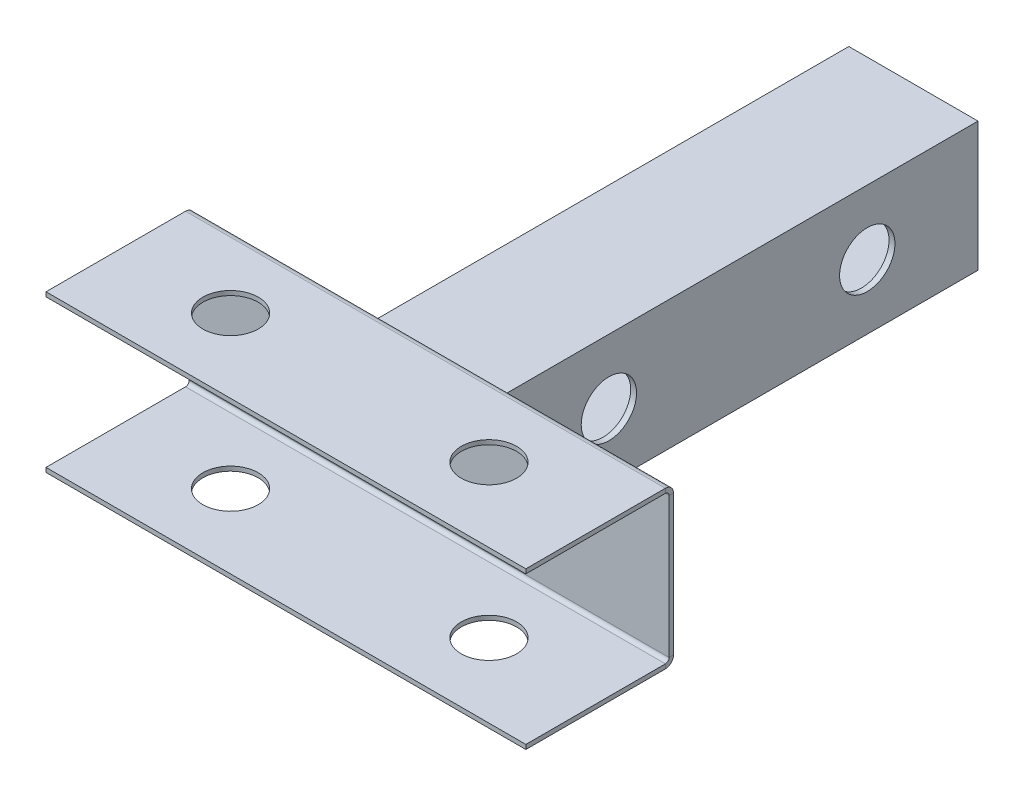
from build123d import *

# Parameters (mm, degrees)
CROQUIS11_W                        = 35
CROQUIS11_H                        = 35
CROQUIS11_W_2                      = 31.8
CROQUIS11_H_2                      = 31.8
CUADRADO_35X35X1_6_1_DEPTH         = 130
CORTAR_EXTRUIR1_DEPTH              = 76.869954527
CORTAR_EXTRUIR1_DEPTH_BACK         = 76.869954527
CROQUIS12_R                        = 7.5
CROQUIS14_W                        = 40
CROQUIS14_H                        = 130
BRIDA_BASE1_DEPTH                  = 1.2
BRIDA_DE_ARISTA1_STRIP_W           = 6.8
BRIDA_DE_ARISTA1_STRIP_H           = 1.2
BRIDA_DE_ARISTA1_STRIP_CUT_DEPTH   = 130
BRIDA_DE_ARISTA1_STRIP_2_W         = 6.8
BRIDA_DE_ARISTA1_STRIP_2_H         = 1.2
BRIDA_DE_ARISTA1_STRIP_CUT_2_DEPTH = 130
BRIDA_DE_ARISTA1_DEPTH             = 130
BRIDA_DE_ARISTA1_BEND_DEPTH        = 130
CORTAR_EXTRUIR2_DEPTH              = 131.567070887
CORTAR_EXTRUIR2_DEPTH_BACK         = 131.567070887
CROQUIS26_R                        = 7.5
S_LIDO_MOVER_COPIAR1_ANGLE         = 90


# Sheet-metal steps are written as plain solids
with BuildPart() as part:
    # Croquis11 → Cuadrado 35X35X1.6(1) (new body)
    with BuildSketch(Plane(origin=(0, 0, 65), x_dir=(-1, 0, 0), z_dir=(0, 0, -1))):
        Rectangle(CROQUIS11_W, CROQUIS11_H)
        Rectangle(CROQUIS11_W_2, CROQUIS11_H_2, mode=Mode.SUBTRACT)
    extrude(amount=CUADRADO_35X35X1_6_1_DEPTH)

    # Croquis12 → Cortar-Extruir1 (cut, two sides: drawn at the far end of the back side and taken through both)
    with BuildSketch(Plane.ZY.offset(17.5).offset(-CORTAR_EXTRUIR1_DEPTH_BACK)):
        with Locations(Location((35, 0, 0), (0, 0, 180))):
            Circle(CROQUIS12_R)
        with Locations(Location((-35, 0, 0), (0, 0, 180))):
            Circle(CROQUIS12_R)
    extrude(amount=CORTAR_EXTRUIR1_DEPTH + CORTAR_EXTRUIR1_DEPTH_BACK, mode=Mode.SUBTRACT)


with BuildPart() as body_2:
    # Croquis14 → Brida base1 (new body)
    with BuildSketch(Plane.XY.offset(65)):
        Rectangle(CROQUIS14_W, CROQUIS14_H)
    extrude(amount=BRIDA_BASE1_DEPTH)

    # Brida de arista1 strip (across the edge) → Brida de arista1 strip cut (cut)
    with BuildSketch(Plane(origin=(20, -65, 66.2), x_dir=(-1, 0, 0), z_dir=(0, 1, 0))):
        with Locations((-2.4, -0.6)):
            Rectangle(BRIDA_DE_ARISTA1_STRIP_W, BRIDA_DE_ARISTA1_STRIP_H)
    extrude(amount=BRIDA_DE_ARISTA1_STRIP_CUT_DEPTH, mode=Mode.SUBTRACT)

    # Brida de arista1 strip 2 (across the edge) → Brida de arista1 strip cut 2 (cut)
    with BuildSketch(Plane(origin=(-20, 65, 66.2), x_dir=(1, 0, 0), z_dir=(0, -1, 0))):
        with Locations((-2.4, -0.6)):
            Rectangle(BRIDA_DE_ARISTA1_STRIP_2_W, BRIDA_DE_ARISTA1_STRIP_2_H)
    extrude(amount=BRIDA_DE_ARISTA1_STRIP_CUT_2_DEPTH, mode=Mode.SUBTRACT)

    # Brida de arista1 section (across the edge) → Brida de arista1 (add)
    with BuildSketch(Plane(origin=(20, -65, 66.2), x_dir=(-1, 0, 0), z_dir=(0, 1, 0))):
        with BuildLine():
            Line((-1.2, 1), (-1.2, 38.8))
            Line((-1.2, 38.8), (0, 38.8))
            Line((0, 38.8), (0, 1))
            ThreePointArc((0, 1), (0.292893219, 0.292893219), (1, 0))
            Line((1, 0), (1, -1.2))
            ThreePointArc((1, -1.2), (-0.555634919, -0.555634919), (-1.2, 1))
        make_face()
    extrude(amount=BRIDA_DE_ARISTA1_DEPTH)

    # Brida de arista1 section 2 (across the edge) → Brida de arista1 bend (add)
    with BuildSketch(Plane(origin=(-20, 65, 66.2), x_dir=(1, 0, 0), z_dir=(0, -1, 0))):
        with BuildLine():
            Line((-1.2, 1), (-1.2, 38.8))
            Line((-1.2, 38.8), (0, 38.8))
            Line((0, 38.8), (0, 1))
            ThreePointArc((0, 1), (0.292893219, 0.292893219), (1, 0))
            Line((1, 0), (1, -1.2))
            ThreePointArc((1, -1.2), (-0.555634919, -0.555634919), (-1.2, 1))
        make_face()
    extrude(amount=BRIDA_DE_ARISTA1_BEND_DEPTH)

    # Croquis26 → Cortar-Extruir2 (cut, two sides: drawn at the far end of the back side and taken through both)
    with BuildSketch(Plane.ZY.offset(21.2).offset(-CORTAR_EXTRUIR2_DEPTH_BACK)):
        with Locations((85, 35)):
            Circle(CROQUIS26_R)
        with Locations((85, -35)):
            Circle(CROQUIS26_R)
    extrude(amount=CORTAR_EXTRUIR2_DEPTH + CORTAR_EXTRUIR2_DEPTH_BACK, mode=Mode.SUBTRACT)


with BuildPart() as body_2_1:
    # Sólido-Mover/Copiar1: moved
    add(body_2.part.rotate(Axis((0, 0, 0), (0, 0, -1)), S_LIDO_MOVER_COPIAR1_ANGLE))


solid = Compound([part.part, body_2_1.part])
